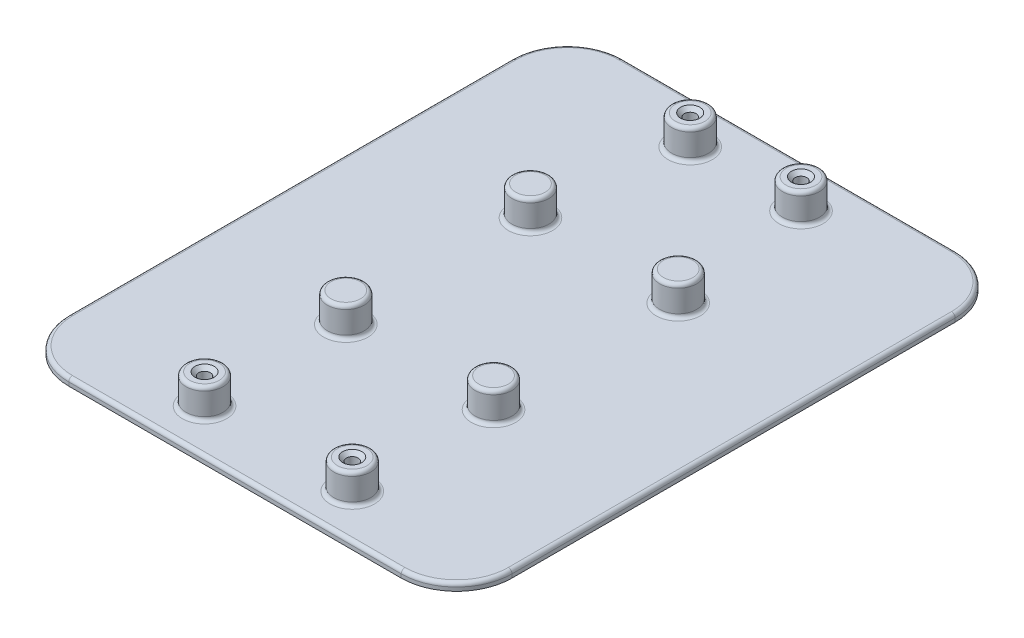
from build123d import *

# Parameters (mm, degrees)
BOSS_EXTRUDE1_DEPTH = 2
SKETCH2_R           = 5
BOSS_EXTRUDE2_DEPTH = 8
SKETCH3_R           = 1.5875
CUT_EXTRUDE1_DEPTH  = 5
FILLET1_R           = 1
CHAMFER1_SIZE       = 1


with BuildPart() as part:
    # Sketch1 → Boss-Extrude1 (new body)
    with BuildSketch(Plane(origin=(0, 0, 0), x_dir=(1, 0, 0), z_dir=(0, 1, 0))):
        with BuildLine():
            Line((15, 0), (105, 0))
            ThreePointArc((105, 0), (115.606601718, 4.393398282), (120, 15))
            Line((120, 15), (120, 135))
            ThreePointArc((120, 135), (115.606601718, 145.606601718), (105, 150))
            Line((105, 150), (15, 150))
            ThreePointArc((15, 150), (4.393398282, 145.606601718), (0, 135))
            Line((0, 135), (0, 15))
            ThreePointArc((0, 15), (4.393398282, 4.393398282), (15, 0))
        make_face()
    extrude(amount=BOSS_EXTRUDE1_DEPTH)

    # Sketch2 → Boss-Extrude2 (add)
    with BuildSketch(Plane(origin=(0, 2, 0), x_dir=(1, 0, 0), z_dir=(0, 1, 0))):
        with Locations((45, 138.25)):
            Circle(SKETCH2_R)
        with Locations((75, 138.25)):
            Circle(SKETCH2_R)
        with Locations((40, 11.75)):
            Circle(SKETCH2_R)
        with Locations((80, 11.75)):
            Circle(SKETCH2_R)
        with Locations((40, 50)):
            Circle(SKETCH2_R)
        with Locations((80, 50)):
            Circle(SKETCH2_R)
        with Locations((40, 100)):
            Circle(SKETCH2_R)
        with Locations((80, 100)):
            Circle(SKETCH2_R)
    extrude(amount=BOSS_EXTRUDE2_DEPTH)

    # Sketch3 → Cut-Extrude1 (cut)
    with BuildSketch(Plane(origin=(0, 10, 0), x_dir=(1, 0, 0), z_dir=(0, 1, 0))):
        with Locations((45, 138.25)):
            Circle(SKETCH3_R)
        with Locations((75, 138.25)):
            Circle(SKETCH3_R)
        with Locations((40, 11.75)):
            Circle(SKETCH3_R)
        with Locations((80, 11.75)):
            Circle(SKETCH3_R)
    extrude(amount=-CUT_EXTRUDE1_DEPTH, mode=Mode.SUBTRACT)

    # Fillet1
    fillet1_edges = [part.edges().sort_by_distance(p)[0] for p in [
        (0, 2, -75),
        (4.393398282, 2, -145.606601718),
        (60, 2, -150),
        (115.606601718, 2, -145.606601718),
        (120, 2, -75),
        (115.606601718, 2, -4.393398282),
        (60, 2, 0),
        (70, 10, -138.25),
        (40, 10, -138.25),
        (75, 10, -11.75),
        (35, 10, -11.75),
        (4.393398282, 2, -4.393398282),
        (75, 2, -11.75),
        (35, 2, -11.75),
        (70, 2, -138.25),
        (40, 2, -138.25),
        (75, 10, -100),
        (35, 10, -50),
        (75, 10, -50),
        (35, 10, -100),
        (75, 2, -50),
        (35, 2, -100),
        (35, 2, -50),
        (75, 2, -100),
    ]]
    fillet(fillet1_edges, radius=FILLET1_R)

    # Chamfer1
    chamfer1_edges = [part.edges().sort_by_distance(p)[0] for p in [
        (78.4125, 10, -11.75),
        (38.4125, 10, -11.75),
        (73.4125, 10, -138.25),
        (43.4125, 10, -138.25),
    ]]
    chamfer(chamfer1_edges, length=CHAMFER1_SIZE)


solid = part.part
